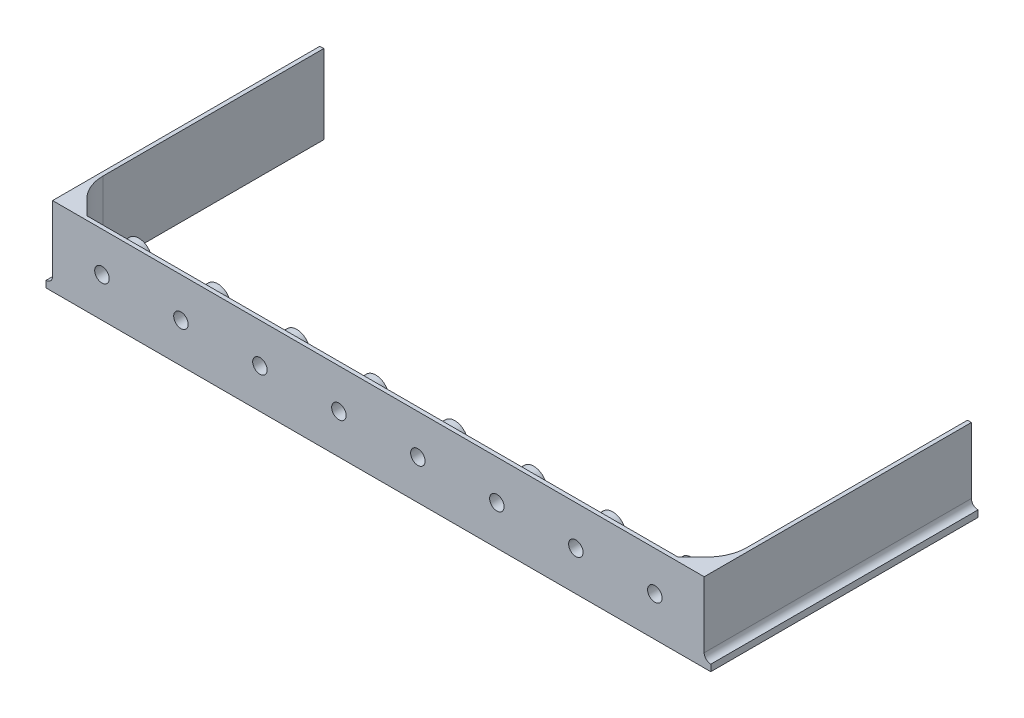
from build123d import *

# Parameters (mm, degrees)
SKETCH_1_W             = 495
SKETCH_1_H             = 60
EXTRUDE_1_DEPTH        = 3
SKETCH_2_W             = 3
SKETCH_2_H             = 60
EXTRUDE_2_DEPTH        = 200
EXTRUDE_3_DEPTH        = 60
SKETCH_4_R             = 10
EXTRUDE_4_DEPTH        = 25
SKETCH_5_R             = 5.5
CUT_EXTRUDE_1_DEPTH    = 529.441103625
PATTERN_LINEAR_1_COUNT = 8
PATTERN_LINEAR_1_PITCH = 60
FILLET_1_R             = 30
SKETCH_6_W             = 203
SKETCH_6_H             = 5
EXTRUDE_5_DEPTH        = 5
SKETCH_7_W             = 203
SKETCH_7_H             = 5
EXTRUDE_6_DEPTH        = 5
FILLET_2_R             = 5
FILLET_3_R             = 5


with BuildPart() as part:
    # 草图1 → 凸台-拉伸1 (new body)
    with BuildSketch(Plane.XY):
        with Locations((247.5, 30)):
            Rectangle(SKETCH_1_W, SKETCH_1_H)
    extrude(amount=EXTRUDE_1_DEPTH)

    # 草图2 → 凸台-拉伸2 (add)
    with BuildSketch(Plane(origin=(0, 0, 0), x_dir=(-1, 0, 0), z_dir=(0, 0, -1))):
        with Locations((-493.5, 30)):
            Rectangle(SKETCH_2_W, SKETCH_2_H)
        with Locations((-1.5, 30)):
            Rectangle(SKETCH_2_W, SKETCH_2_H)
    extrude(amount=EXTRUDE_2_DEPTH)

    # 草图3 → 凸台-拉伸3 (add)
    with BuildSketch(Plane.XZ):
        Polygon((3, -20), (23, 0), (3, 0), align=None)
        Polygon((472, 0), (492, 0), (492, -20), align=None)
    extrude(amount=-EXTRUDE_3_DEPTH)

    # 草图4 → 凸台-拉伸4 (add)
    with BuildSketch(Plane(origin=(0, 0, 0), x_dir=(-1, 0, 0), z_dir=(0, 0, -1))):
        with Locations((-457.5, 30)):
            Circle(SKETCH_4_R)
    extrude_4 = extrude(amount=EXTRUDE_4_DEPTH)

    # 草图5 → 切除-拉伸1 (cut, through all)
    with BuildSketch(Plane(origin=(0, 0, -25), x_dir=(-1, 0, 0), z_dir=(0, 0, -1))):
        with Locations((-457.5, 30)):
            Circle(SKETCH_5_R)
    cut_extrude_1 = extrude(amount=-CUT_EXTRUDE_1_DEPTH, mode=Mode.SUBTRACT)

    # 阵列(线性)1: 凸台-拉伸4, 切除-拉伸1 ×8
    with Locations(*[(-i * PATTERN_LINEAR_1_PITCH, 0, 0) for i in range(1, PATTERN_LINEAR_1_COUNT)]):
        add(extrude_4)
        add(cut_extrude_1, mode=Mode.SUBTRACT)

    # 圆角1
    fillet_1_edges = [part.edges().sort_by_distance(p)[0] for p in [
        (3, 30, -20),
        (492, 30, -20),
    ]]
    fillet(fillet_1_edges, radius=FILLET_1_R)

    # 草图6 → 凸台-拉伸5 (add)
    with BuildSketch(Plane.ZY):
        with Locations((-98.5, 2.5)):
            Rectangle(SKETCH_6_W, SKETCH_6_H)
    extrude(amount=EXTRUDE_5_DEPTH)

    # 草图7 → 凸台-拉伸6 (add)
    with BuildSketch(Plane(origin=(495, 0, 0), x_dir=(0, 0, -1), z_dir=(1, 0, 0))):
        with Locations((98.5, 2.5)):
            Rectangle(SKETCH_7_W, SKETCH_7_H)
    extrude(amount=EXTRUDE_6_DEPTH)

    # 圆角2
    fillet_2_edges = [part.edges().sort_by_distance(p)[0] for p in [
        (0, 5, -98.5),
    ]]
    fillet(fillet_2_edges, radius=FILLET_2_R - 0.0001)  # a hair under: the kernel refuses the full size

    # 圆角3
    fillet_3_edges = [part.edges().sort_by_distance(p)[0] for p in [
        (495, 5, -98.5),
    ]]
    fillet(fillet_3_edges, radius=FILLET_3_R - 0.0001)  # a hair under: the kernel refuses the full size


solid = part.part
